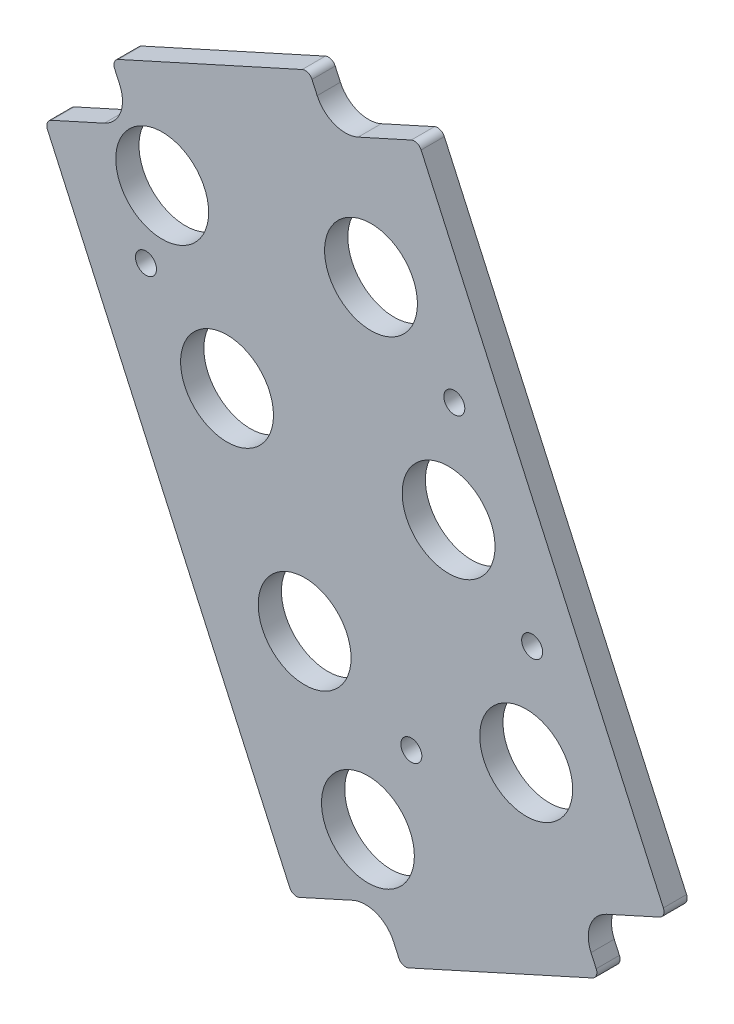
from build123d import *

# Parameters (mm, degrees)
BOSS_EXTRUDE1_DEPTH   = 4.7625
F_6_CLEARANCE_HOLE1_D = 4.3053
SKETCH6_R             = 9.525
CUT_EXTRUDE1_DEPTH    = 110.536113073


with BuildPart() as part:
    # Sketch1 → Boss-Extrude1 (new body)
    with BuildSketch(Plane.XY):
        with BuildLine():
            Line((61.328308874, -51.443881834), (72.233641051, -46.509447198))
            ThreePointArc((72.233641051, -46.509447198), (73.031430575, -45.658526875), (72.993861427, -44.492712962))
            Line((72.993861427, -44.492712962), (23.309209228, 65.312700679))
            ThreePointArc((23.309209228, 65.312700679), (22.458288905, 66.110490204), (21.292474992, 66.072921056))
            Line((21.292474992, 66.072921056), (10.387142815, 61.13848642))
            ThreePointArc((10.387142815, 61.13848642), (5.529584843, 60.981948303), (1.984083498, 64.306071322))
            Line((1.984083498, 64.306071322), (0.923899929, 66.649126776))
            ThreePointArc((0.923899929, 66.649126776), (0.072979606, 67.4469163), (-1.092834307, 67.409347153))
            Line((-1.092834307, 67.409347153), (-38.813134462, 50.341700559))
            ThreePointArc((-38.813134462, 50.341700559), (-39.610923987, 49.490780236), (-39.573354839, 48.324966323))
            Line((-39.573354839, 48.324966323), (-38.51317127, 45.981910869))
            ThreePointArc((-38.51317127, 45.981910869), (-38.356633153, 41.124352897), (-41.680756172, 37.578851552))
            Line((-41.680756172, 37.578851552), (-52.586088348, 32.644416915))
            ThreePointArc((-52.586088348, 32.644416915), (-53.383877873, 31.793496593), (-53.346308725, 30.627682679))
            Line((-53.346308725, 30.627682679), (-3.661656526, -79.177730962))
            ThreePointArc((-3.661656526, -79.177730962), (-2.810736203, -79.975520486), (-1.64492229, -79.937951338))
            Line((-1.64492229, -79.937951338), (9.260409887, -75.003516702))
            ThreePointArc((9.260409887, -75.003516702), (14.117967859, -74.846978586), (17.663469204, -78.171101604))
            Line((17.663469204, -78.171101604), (18.723652773, -80.514157058))
            ThreePointArc((18.723652773, -80.514157058), (19.574573096, -81.311946583), (20.740387009, -81.274377435))
            Line((20.740387009, -81.274377435), (58.460687164, -64.206730842))
            ThreePointArc((58.460687164, -64.206730842), (59.258476689, -63.355810519), (59.220907541, -62.189996606))
            Line((59.220907541, -62.189996606), (58.160723972, -59.846941151))
            ThreePointArc((58.160723972, -59.846941151), (58.004185856, -54.989383179), (61.328308874, -51.443881834))
        make_face()
    extrude(amount=BOSS_EXTRUDE1_DEPTH)

    # #6 Clearance Hole1 (through all)
    with Locations(Plane.XY.offset(4.7625)):
        with Locations((30.114722566, 23.855073088), (46.082919532, -11.435391781), (-33.128884005, 16.984419854), (21.298547528, -42.304619004)):
            Hole(F_6_CLEARANCE_HOLE1_D / 2)

    # Sketch6 → Cut-Extrude1 (cut, through all)
    with BuildSketch(Plane.XY.offset(4.7625)):
        with Locations((13.026989476, 37.590195142)):
            Circle(SKETCH6_R)
        with Locations((28.942831698, 2.415436715)):
            Circle(SKETCH6_R)
        with Locations((44.858673919, -32.759321712)):
            Circle(SKETCH6_R)
        with Locations((-16.503976684, 3.039878823)):
            Circle(SKETCH6_R)
        with Locations((-0.588134462, -32.134879603)):
            Circle(SKETCH6_R)
        with Locations((-29.802081698, 32.42931514)):
            Circle(SKETCH6_R)
        with Locations((12.395842088, -60.830077267)):
            Circle(SKETCH6_R)
    extrude(amount=-CUT_EXTRUDE1_DEPTH, mode=Mode.SUBTRACT)


solid = part.part
